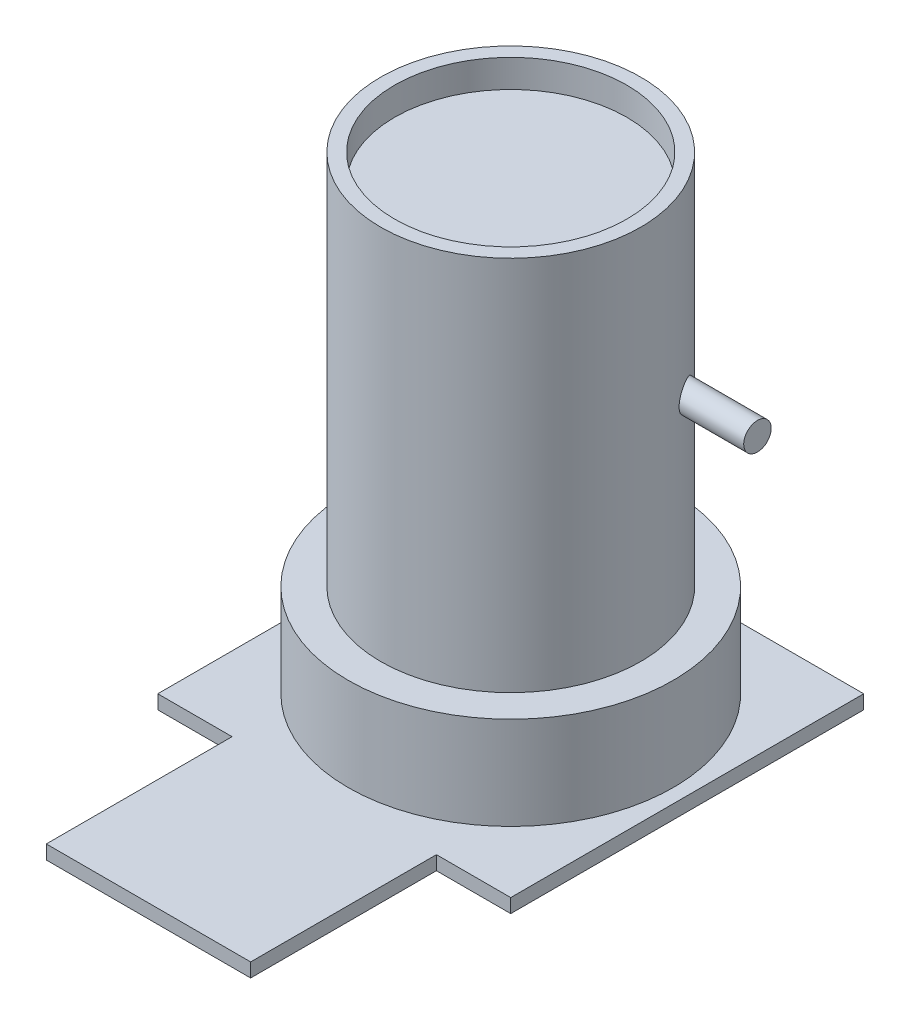
from build123d import *

# Parameters (mm, degrees)
SKETCH1_W           = 38
SKETCH1_H           = 38
BOSS_EXTRUDE1_DEPTH = 1.5
SKETCH2_R           = 17.5
BOSS_EXTRUDE2_DEPTH = 10
SKETCH3_R           = 14
BOSS_EXTRUDE3_DEPTH = 40.5
SKETCH4_R           = 12.5
CUT_EXTRUDE1_DEPTH  = 3
SKETCH5_R           = 1.478595514
BOSS_EXTRUDE4_DEPTH = 20
SKETCH6_W           = 22
SKETCH6_H           = 1.5
BOSS_EXTRUDE5_DEPTH = 20


with BuildPart() as part:
    # Sketch1 → Boss-Extrude1 (new body)
    with BuildSketch(Plane(origin=(0, 0, 0), x_dir=(1, 0, 0), z_dir=(0, 1, 0))):
        Rectangle(SKETCH1_W, SKETCH1_H)
    extrude(amount=BOSS_EXTRUDE1_DEPTH)

    # Sketch2 → Boss-Extrude2 (add)
    with BuildSketch(Plane(origin=(0, 1.5, 0), x_dir=(1, 0, 0), z_dir=(0, 1, 0))):
        Circle(SKETCH2_R)
    extrude(amount=BOSS_EXTRUDE2_DEPTH)

    # Sketch3 → Boss-Extrude3 (add)
    with BuildSketch(Plane(origin=(0, 11.5, 0), x_dir=(1, 0, 0), z_dir=(0, 1, 0))):
        Circle(SKETCH3_R)
    extrude(amount=BOSS_EXTRUDE3_DEPTH)

    # Sketch4 → Cut-Extrude1 (cut)
    with BuildSketch(Plane(origin=(0, 52, 0), x_dir=(1, 0, 0), z_dir=(0, 1, 0))):
        Circle(SKETCH4_R)
    extrude(amount=-CUT_EXTRUDE1_DEPTH, mode=Mode.SUBTRACT)

    # Sketch5 → Boss-Extrude4 (add)
    with BuildSketch(Plane(origin=(0, 0, 0), x_dir=(0, 0, -1), z_dir=(1, 0, 0))):
        with Locations((6.558582487, 32.23)):
            Circle(SKETCH5_R)
    extrude(amount=BOSS_EXTRUDE4_DEPTH)

    # Sketch6 → Boss-Extrude5 (add)
    with BuildSketch(Plane.XY.offset(19)):
        with Locations((0, 0.75)):
            Rectangle(SKETCH6_W, SKETCH6_H)
    extrude(amount=BOSS_EXTRUDE5_DEPTH)


solid = part.part
